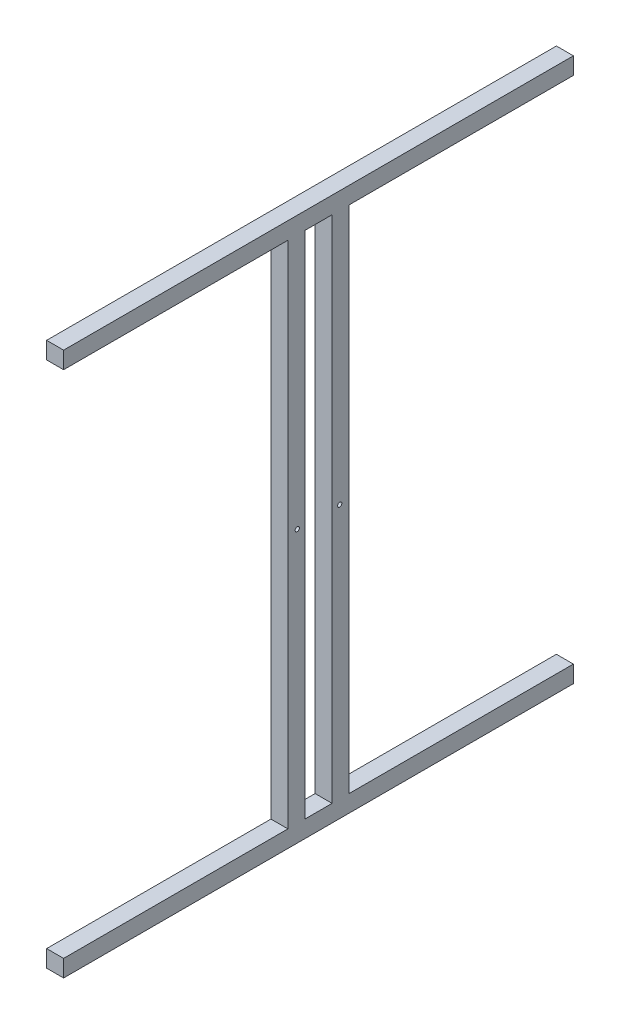
from build123d import *

# Parameters (mm, degrees)
SKETCH1_W               = 32
SKETCH1_H               = 600
BOSS_EXTRUDE1_DEPTH     = 20
CUT_EXTRUDE1_DEPTH      = 1289.409872673
CUT_EXTRUDE1_DEPTH_BACK = 1289.409872673
SKETCH3_R               = 2.5


with BuildPart() as part:
    # Sketch1 → Boss-Extrude1 (new body)
    with BuildSketch(Plane(origin=(0, 0, 0), x_dir=(0, 0, -1), z_dir=(1, 0, 0))):
        Polygon((0, -500), (-600, -500), (-600, -520), (-336, -520), (-336, -1120), (-600, -1120), (-600, -1140), (0, -1140), (0, -1120), (-264, -1120), (-264, -520), (0, -520), align=None)
        with Locations((-300, -820)):
            Rectangle(SKETCH1_W, SKETCH1_H, mode=Mode.SUBTRACT)
    extrude(amount=BOSS_EXTRUDE1_DEPTH)

    # Sketch3 → Cut-Extrude1 (cut, two sides: drawn at the far end of the back side and taken through both)
    with BuildSketch(Plane(origin=(20, 0, 0), x_dir=(0, 0, -1), z_dir=(1, 0, 0)).offset(-CUT_EXTRUDE1_DEPTH_BACK)):
        with Locations((-325, -820)):
            Circle(SKETCH3_R)
        with Locations((-275, -820)):
            Circle(SKETCH3_R)
    extrude(amount=CUT_EXTRUDE1_DEPTH + CUT_EXTRUDE1_DEPTH_BACK, mode=Mode.SUBTRACT)


solid = part.part
